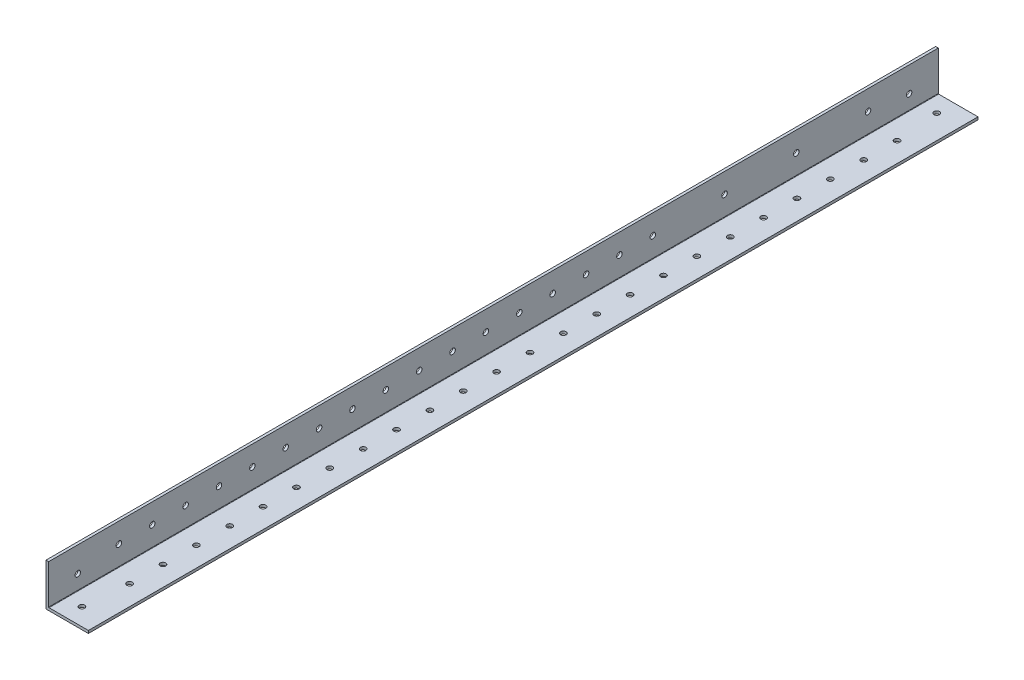
from build123d import *

# Parameters (mm, degrees)
BOSS_EXTRUDE1_DEPTH = 1219.2
FILLET1_R           = 0.254
SKETCH4_W           = 1905.2
SKETCH4_H           = 92.573708452
CUT_EXTRUDE1_DEPTH  = 60
SKETCH9_R           = 1.65
CUT_EXTRUDE6_DEPTH  = 60
SKETCH10_R          = 1.65
CUT_EXTRUDE7_DEPTH  = 60


with BuildPart() as part:
    # Sketch3 → Boss-Extrude1 (new, symmetric)
    with BuildSketch(Plane.XY):
        Polygon((1.5875, 25.4), (0, 25.4), (0, 0), (25.4, 0), (25.4, 1.5875), (1.5875, 1.5875), align=None)
    extrude(amount=BOSS_EXTRUDE1_DEPTH, both=True)

    # Fillet1
    fillet1_edges = [part.edges().sort_by_distance(p)[0] for p in [
        (1.5875, 1.5875, 0),
    ]]
    fillet(fillet1_edges, radius=FILLET1_R)

    # Sketch4 → Cut-Extrude1 (cut)
    with BuildSketch(Plane.ZY):
        with Locations((-266.6, -7.427787689)):
            Rectangle(SKETCH4_W, SKETCH4_H)
    extrude(amount=-CUT_EXTRUDE1_DEPTH, mode=Mode.SUBTRACT)

    # Sketch9 → Cut-Extrude6 (cut)
    with BuildSketch(Plane(origin=(0, 1.5875, 0), x_dir=(1, 0, 0), z_dir=(0, 1, 0))):
        with Locations((11.113, -1208.791795667)):
            Circle(SKETCH9_R)
        with Locations((11.1125, -696.408204333)):
            Circle(SKETCH9_R)
        with Locations((13.49375, -1182.6)):
            Circle(SKETCH9_R)
        with Locations((13.49375, -1162.6)):
            Circle(SKETCH9_R)
        with Locations((13.49375, -1142.6)):
            Circle(SKETCH9_R)
        with Locations((13.49375, -1122.6)):
            Circle(SKETCH9_R)
        with Locations((13.49375, -1102.6)):
            Circle(SKETCH9_R)
        with Locations((13.49375, -1082.6)):
            Circle(SKETCH9_R)
        with Locations((13.49375, -1062.6)):
            Circle(SKETCH9_R)
        with Locations((13.49375, -1042.6)):
            Circle(SKETCH9_R)
        with Locations((13.49375, -1022.6)):
            Circle(SKETCH9_R)
        with Locations((13.49375, -1002.6)):
            Circle(SKETCH9_R)
        with Locations((13.49375, -982.6)):
            Circle(SKETCH9_R)
        with Locations((13.49375, -962.6)):
            Circle(SKETCH9_R)
        with Locations((13.49375, -942.6)):
            Circle(SKETCH9_R)
        with Locations((13.49375, -922.6)):
            Circle(SKETCH9_R)
        with Locations((13.49375, -902.6)):
            Circle(SKETCH9_R)
        with Locations((13.49375, -882.6)):
            Circle(SKETCH9_R)
        with Locations((13.49375, -862.6)):
            Circle(SKETCH9_R)
        with Locations((13.49375, -842.6)):
            Circle(SKETCH9_R)
        with Locations((13.49375, -822.6)):
            Circle(SKETCH9_R)
        with Locations((13.49375, -802.6)):
            Circle(SKETCH9_R)
        with Locations((13.49375, -782.6)):
            Circle(SKETCH9_R)
        with Locations((13.49375, -762.6)):
            Circle(SKETCH9_R)
        with Locations((13.49375, -742.6)):
            Circle(SKETCH9_R)
        with Locations((13.49375, -722.6)):
            Circle(SKETCH9_R)
    extrude(amount=-CUT_EXTRUDE6_DEPTH, mode=Mode.SUBTRACT)

    # Sketch10 → Cut-Extrude7 (cut)
    with BuildSketch(Plane(origin=(1.5875, 0, 0), x_dir=(0, 0, -1), z_dir=(1, 0, 0))):
        with Locations((-703.4625, 10.3759)):
            Circle(SKETCH10_R)
        with Locations((-1201.7375, 10.3759)):
            Circle(SKETCH10_R)
        with Locations((-728.1, 13.49375)):
            Circle(SKETCH10_R)
        with Locations((-771.1, 13.49375)):
            Circle(SKETCH10_R)
        with Locations((-814.1, 13.49375)):
            Circle(SKETCH10_R)
        with Locations((-857.1, 13.49375)):
            Circle(SKETCH10_R)
        with Locations((-877.1, 13.49375)):
            Circle(SKETCH10_R)
        with Locations((-897.1, 13.49375)):
            Circle(SKETCH10_R)
        with Locations((-917.1, 13.49375)):
            Circle(SKETCH10_R)
        with Locations((-937.1, 13.49375)):
            Circle(SKETCH10_R)
        with Locations((-957.1, 13.49375)):
            Circle(SKETCH10_R)
        with Locations((-977.1, 13.49375)):
            Circle(SKETCH10_R)
        with Locations((-997.1, 13.49375)):
            Circle(SKETCH10_R)
        with Locations((-1017.1, 13.49375)):
            Circle(SKETCH10_R)
        with Locations((-1037.1, 13.49375)):
            Circle(SKETCH10_R)
        with Locations((-1057.1, 13.49375)):
            Circle(SKETCH10_R)
        with Locations((-1077.1, 13.49375)):
            Circle(SKETCH10_R)
        with Locations((-1097.1, 13.49375)):
            Circle(SKETCH10_R)
        with Locations((-1117.1, 13.49375)):
            Circle(SKETCH10_R)
        with Locations((-1137.1, 13.49375)):
            Circle(SKETCH10_R)
        with Locations((-1157.1, 13.49375)):
            Circle(SKETCH10_R)
        with Locations((-1177.1, 13.49375)):
            Circle(SKETCH10_R)
    extrude(amount=-CUT_EXTRUDE7_DEPTH, mode=Mode.SUBTRACT)


solid = part.part
